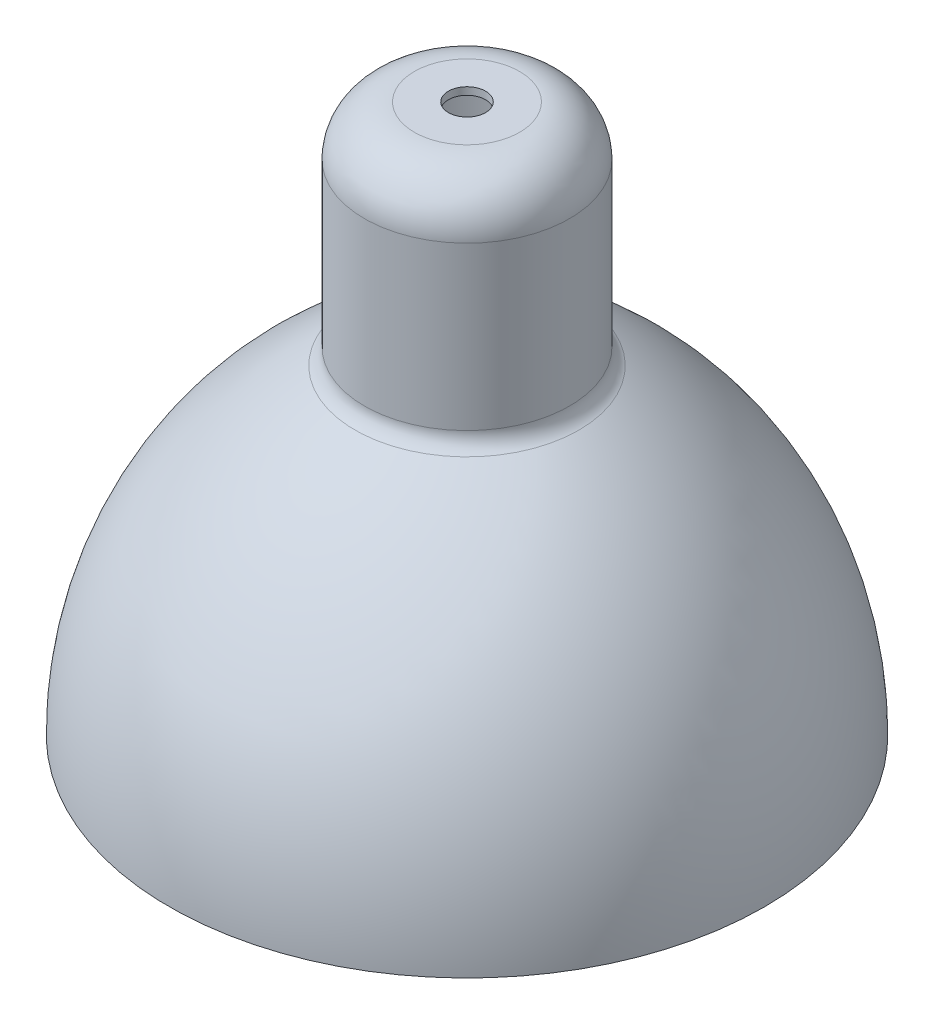
from build123d import *

# Parameters (mm, degrees)
SKETCH2_R               = 100
CUT_EXTRUDE2_DEPTH      = 110
FILLET1_R               = 100
FILLET2_R               = 100
CUT_EXTRUDE3_REACH      = 2722.623
CUT_EXTRUDE3_END_RADIUS = 551.552795031
SKETCH3_R               = 30


# Read off the part's stored shape, not the designer's step: Shell3
with BuildPart() as part:
    # Sketch1 → Revolve1 (revolve)
    with BuildSketch(Plane.XY):
        with BuildLine():
            Line((0, 1510.559006211), (0, -1438.50931677))
            Line((0, -1438.50931677), (-1600, -1438.50931677))
            ThreePointArc((-1600, -1438.50931677), (-1317.811601989, -418.891552598), (-551.552795031, 310.559006211))
            Line((-551.552795031, 310.559006211), (-551.552795031, 1242.236024845))
            ThreePointArc((-551.552795031, 1242.236024845), (-472.962813337, 1431.969024517), (-283.229813665, 1510.559006211))
            Line((-283.229813665, 1510.559006211), (0, 1510.559006211))
        make_face()
    revolve(axis=Axis((0, 1855.900621118, 0), (0, -1, 0)))

    # Shell3 outline → Shell3 (revolve, cut)
    with BuildSketch(Plane.XY):
        with BuildLine():
            Line((283.229813665, 1470.559006211), (0, 1470.559006211))
            Line((0, 1470.559006211), (0, -1438.50931677))
            Line((0, -1438.50931677), (1560, -1438.50931677))
            ThreePointArc((1560, -1438.50931677), (1277.328041786, -429.226679984), (511.552795031, 286.415093765))
            Line((511.552795031, 286.415093765), (511.552795031, 1242.236024845))
            ThreePointArc((511.552795031, 1242.236024845), (444.67854209, 1403.68475327), (283.229813665, 1470.559006211))
        make_face()
    revolve(axis=Axis((0, 0, 0), (0, 1, 0)), mode=Mode.SUBTRACT)

    # Sketch2 → Cut-Extrude2 (cut)
    with BuildSketch(Plane(origin=(0, 1510.559006211, 0), x_dir=(1, 0, 0), z_dir=(0, 1, 0))):
        with Locations(Location((0, 0, 0), (0, 0, 270))):
            Circle(SKETCH2_R)
    extrude(amount=-CUT_EXTRUDE2_DEPTH, mode=Mode.SUBTRACT)

    # Fillet1
    fillet1_edges = [part.edges().sort_by_distance(p)[0] for p in [
        (551.552795031, 310.559006211, 0),
    ]]
    fillet(fillet1_edges, radius=FILLET1_R)

    # Fillet2
    fillet2_edges = [part.edges().sort_by_distance(p)[0] for p in [
        (-511.552795031, 286.415093765, 0),
    ]]
    fillet(fillet2_edges, radius=FILLET2_R)

    # Cut-Extrude3: up to this cylinder (the profile starts inside it)
    cut_extrude3_end = Plane(origin=(0, 805.872403, 0), z_dir=(0, 1, 0)) * Cylinder(CUT_EXTRUDE3_END_RADIUS, 6829.351590062, mode=Mode.PRIVATE)
    # Sketch3 → Cut-Extrude3 (cut, up to the surface)
    with BuildSketch(Plane.XY, mode=Mode.PRIVATE) as cut_extrude3_sk1:
        with Locations((0, 945.872402589)):
            Circle(SKETCH3_R)
    cut_extrude3_tool1 = extrude(cut_extrude3_sk1.sketch, amount=-CUT_EXTRUDE3_REACH, mode=Mode.PRIVATE) & cut_extrude3_end
    add(cut_extrude3_tool1.solids().sort_by_distance((0, 945.872403, 0))[0], mode=Mode.SUBTRACT)
    # Sketch3 → Cut-Extrude3 (cut, up to the surface)
    with BuildSketch(Plane.XY, mode=Mode.PRIVATE) as cut_extrude3_sk2:
        with Locations((0, 665.872402589)):
            Circle(SKETCH3_R)
    cut_extrude3_tool2 = extrude(cut_extrude3_sk2.sketch, amount=-CUT_EXTRUDE3_REACH, mode=Mode.PRIVATE) & cut_extrude3_end
    add(cut_extrude3_tool2.solids().sort_by_distance((0, 665.872403, 0))[0], mode=Mode.SUBTRACT)


solid = part.part
